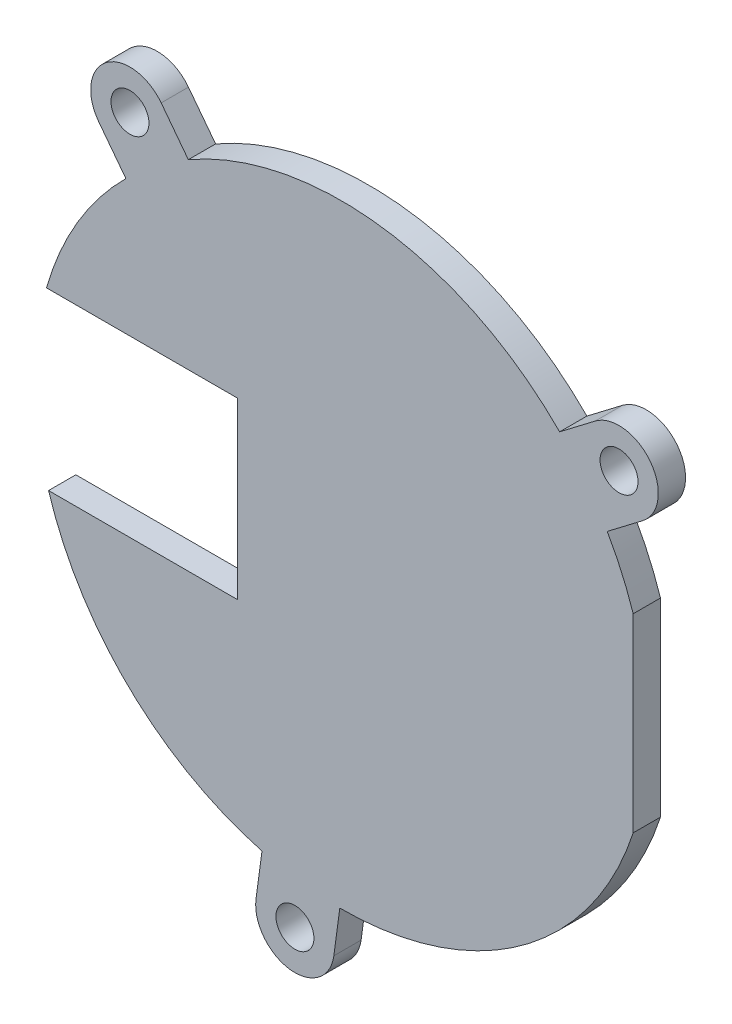
from build123d import *

# Parameters (mm, degrees)
SKETCH1_R           = 1.1049
BOSS_EXTRUDE1_DEPTH = 1.5875


with BuildPart() as part:
    # Sketch1 → Boss-Extrude1 (new body)
    with BuildSketch(Plane.XY):
        with BuildLine():
            Line((-6.056265338, 4.8768), (-17.181244816, 4.8768))
            ThreePointArc((-17.181244816, 4.8768), (-15.375234721, 9.087381854), (-12.557442768, 12.699959952))
            Line((-12.557442768, 12.699959952), (-14.138046409, 14.773078207))
            ThreePointArc((-14.138046409, 14.773078207), (-13.706164911, 17.976993058), (-10.502250061, 17.54511156))
            Line((-10.502250061, 17.54511156), (-8.92164642, 15.471993305))
            ThreePointArc((-8.92164642, 15.471993305), (2.385909574, 17.699880993), (12.699959952, 12.557442768))
            Line((12.699959952, 12.557442768), (14.773078207, 14.138046409))
            ThreePointArc((14.773078207, 14.138046409), (17.976993058, 13.706164911), (17.54511156, 10.502250061))
            Line((17.54511156, 10.502250061), (15.471993305, 8.92164642))
            ThreePointArc((15.471993305, 8.92164642), (16.316677959, 7.26253207), (16.984058744, 5.5245))
            Line((16.984058744, 5.5245), (16.984058744, -5.5245))
            ThreePointArc((16.984058744, -5.5245), (10.454687446, -14.480257667), (-0.100774867, -17.859680739))
            Line((-0.100774867, -17.859680739), (-0.449035291, -20.443252268))
            ThreePointArc((-0.449035291, -20.443252268), (-3.019931544, -22.40337585), (-4.980055125, -19.832479597))
            Line((-4.980055125, -19.832479597), (-4.631794702, -17.248908067))
            ThreePointArc((-4.631794702, -17.248908067), (-12.386896286, -12.866357374), (-17.060660873, -5.2832))
            Line((-17.060660873, -5.2832), (-6.056265338, -5.2832))
            Line((-6.056265338, -5.2832), (-6.056265338, 4.8768))
        make_face()
        with Locations((-2.714545208, -20.137865932)):
            Circle(SKETCH1_R, mode=Mode.SUBTRACT)
        with Locations((-12.320148235, 16.159094884)):
            Circle(SKETCH1_R, mode=Mode.SUBTRACT)
        with Locations((16.159094884, 12.320148235)):
            Circle(SKETCH1_R, mode=Mode.SUBTRACT)
    extrude(amount=BOSS_EXTRUDE1_DEPTH)


solid = part.part
